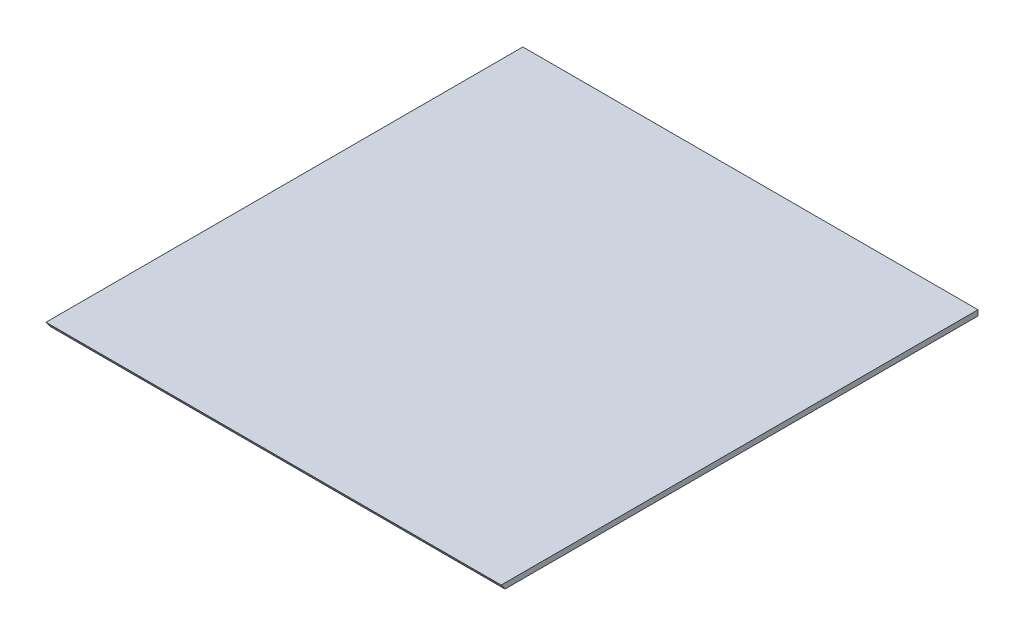
from build123d import *

# Parameters (mm, degrees)
SKETCH1_W           = 266.7
SKETCH1_H           = 279.4
BOSS_EXTRUDE1_DEPTH = 1.5875
CUT_EXTRUDE4_DEPTH  = 302.077232876


with BuildPart() as part:
    # Sketch1 → Boss-Extrude1 (new, symmetric)
    with BuildSketch(Plane(origin=(0, 0, 0), x_dir=(1, 0, 0), z_dir=(0, 1, 0))):
        Rectangle(SKETCH1_W, SKETCH1_H)
    extrude(amount=BOSS_EXTRUDE1_DEPTH, both=True)

    # Sketch2 → Cut-Extrude4 (cut, through all)
    with BuildSketch(Plane.ZY.offset(133.35)):
        Polygon((139.7, 1.5875), (137.447111577, -1.5875), (139.402641273, -2.975087469), (141.655529696, 0.199912531), align=None)
    extrude(amount=-CUT_EXTRUDE4_DEPTH, mode=Mode.SUBTRACT)


solid = part.part
